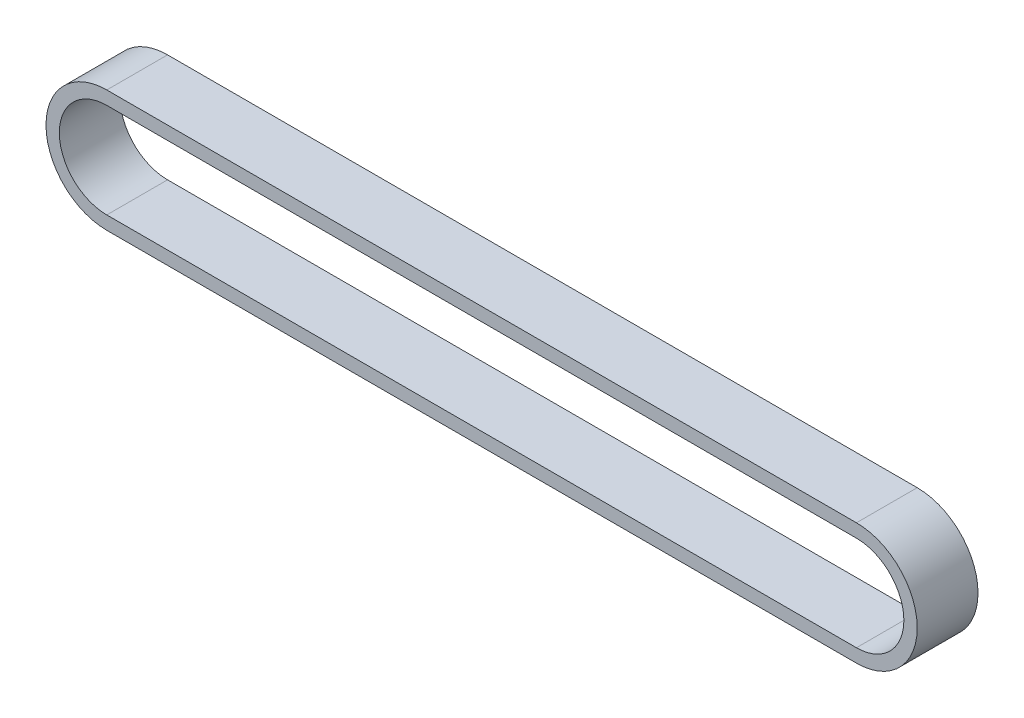
from build123d import *

# Parameters (mm, degrees)
BOSS_EXTRUDE1_DEPTH = 19.05


with BuildPart() as part:
    # Sketch1 → Boss-Extrude1 (new body)
    with BuildSketch(Plane.XY):
        with BuildLine():
            Line((0, -19.05), (-234.95, -19.05))
            ThreePointArc((-234.95, -19.05), (-254, 0), (-234.95, 19.05))
            Line((-234.95, 19.05), (0, 19.05))
            ThreePointArc((0, 19.05), (19.05, 0), (0, -19.05))
        make_face()
        with BuildLine():
            Line((0, -14.868259737), (-234.95, -14.868259737))
            ThreePointArc((-234.95, -14.868259737), (-249.818259737, 0), (-234.95, 14.868259737))
            Line((-234.95, 14.868259737), (0, 14.868259737))
            ThreePointArc((0, 14.868259737), (14.868259737, 0), (0, -14.868259737))
        make_face(mode=Mode.SUBTRACT)
    extrude(amount=BOSS_EXTRUDE1_DEPTH)


solid = part.part
